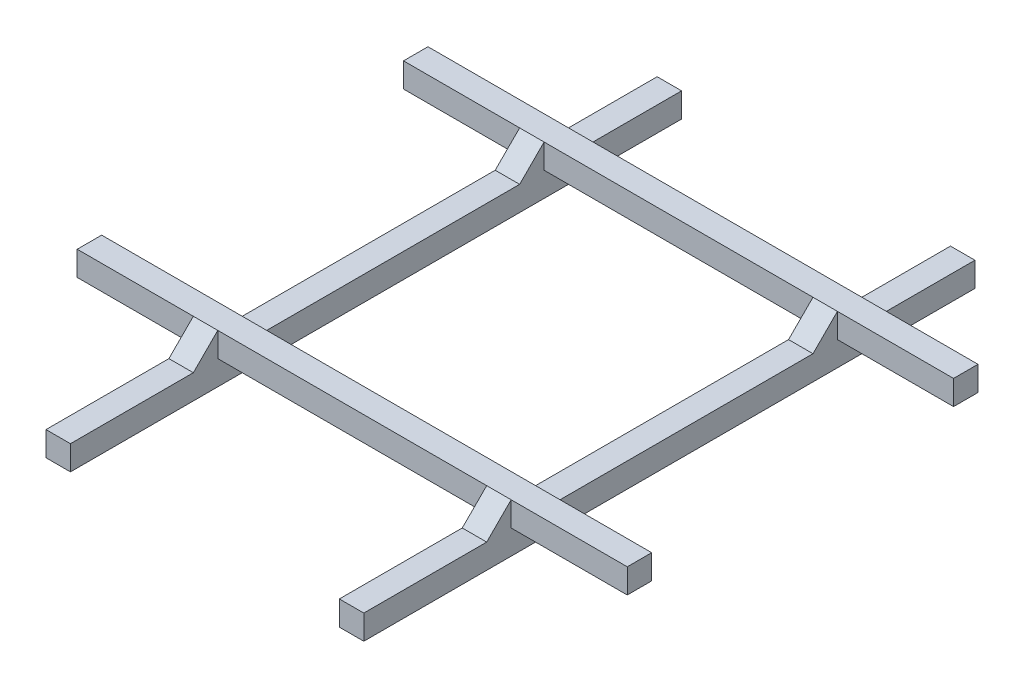
from build123d import *

# Parameters (mm, degrees)
SKETCH_1_W      = 95
SKETCH_1_H      = 20
SKETCH_1_W_2    = 20
SKETCH_1_W_3    = 220
EXTRUDE_4_DEPTH = 20
SKETCH_1_16_W   = 20
SKETCH_1_16_H   = 92.5
SKETCH_1_16_H_2 = 20
SKETCH_1_16_H_3 = 246.95222931
SKETCH_1_16_H_4 = 120.54777069
EXTRUDE_5_DEPTH = 20
CHAMFER_9_SIZE  = 20
CHAMFER_10_SIZE = 20


with BuildPart() as part:
    # 草图1 → 凸台-拉伸4 (new body)
    with BuildSketch(Plane(origin=(0, 0, 0), x_dir=(1, 0, 0), z_dir=(0, 1, 0))):
        with Locations((-177.5, 147.5)):
            Rectangle(SKETCH_1_W, SKETCH_1_H)
        with Locations((-120, 147.5)):
            Rectangle(SKETCH_1_W_2, SKETCH_1_H)
        with Locations((0, 147.5)):
            Rectangle(SKETCH_1_W_3, SKETCH_1_H)
        with Locations((177.5, 147.5)):
            Rectangle(SKETCH_1_W, SKETCH_1_H)
        with Locations((120, 147.5)):
            Rectangle(SKETCH_1_W_2, SKETCH_1_H)
        with Locations((177.5, -119.45222931)):
            Rectangle(SKETCH_1_W, SKETCH_1_H)
        with Locations((120, -119.45222931)):
            Rectangle(SKETCH_1_W_2, SKETCH_1_H)
        with Locations((0, -119.45222931)):
            Rectangle(SKETCH_1_W_3, SKETCH_1_H)
        with Locations((-120, -119.45222931)):
            Rectangle(SKETCH_1_W_2, SKETCH_1_H)
        with Locations((-177.5, -119.45222931)):
            Rectangle(SKETCH_1_W, SKETCH_1_H)
    extrude(amount=EXTRUDE_4_DEPTH)

    # 草图1<16> → 凸台-拉伸5 (add)
    with BuildSketch(Plane(origin=(0, 0, 0), x_dir=(1, 0, 0), z_dir=(0, 1, 0))):
        with Locations((120, 203.75)):
            Rectangle(SKETCH_1_16_W, SKETCH_1_16_H)
        with Locations((120, 147.5)):
            Rectangle(SKETCH_1_16_W, SKETCH_1_16_H_2)
        with Locations((120, 14.023885345)):
            Rectangle(SKETCH_1_16_W, SKETCH_1_16_H_3)
        with Locations((120, -119.45222931)):
            Rectangle(SKETCH_1_16_W, SKETCH_1_16_H_2)
        with Locations((120, -189.726114655)):
            Rectangle(SKETCH_1_16_W, SKETCH_1_16_H_4)
        with Locations((-120, -189.726114655)):
            Rectangle(SKETCH_1_16_W, SKETCH_1_16_H_4)
        with Locations((-120, -119.45222931)):
            Rectangle(SKETCH_1_16_W, SKETCH_1_16_H_2)
        with Locations((-120, 14.023885345)):
            Rectangle(SKETCH_1_16_W, SKETCH_1_16_H_3)
        with Locations((-120, 147.5)):
            Rectangle(SKETCH_1_16_W, SKETCH_1_16_H_2)
        with Locations((-120, 203.75)):
            Rectangle(SKETCH_1_16_W, SKETCH_1_16_H)
    extrude(amount=-EXTRUDE_5_DEPTH)

    # 倒角9
    chamfer_9_edges = [part.edges().sort_by_distance(p)[0] for p in [
        (120, 0, 129.45222931),
    ]]
    chamfer(chamfer_9_edges, length=CHAMFER_9_SIZE - 0.0001)  # a hair under: the kernel refuses the full size

    # 倒角10
    chamfer_10_edges = [part.edges().sort_by_distance(p)[0] for p in [
        (120, 0, -137.5),
        (120, 0, -157.5),
        (120, 0, 109.45222931),
        (-120, 0, 129.45222931),
        (-120, 0, 109.45222931),
        (-120, 0, -137.5),
        (-120, 0, -157.5),
    ]]
    chamfer(chamfer_10_edges, length=CHAMFER_10_SIZE - 0.0001)  # a hair under: the kernel refuses the full size


solid = part.part
